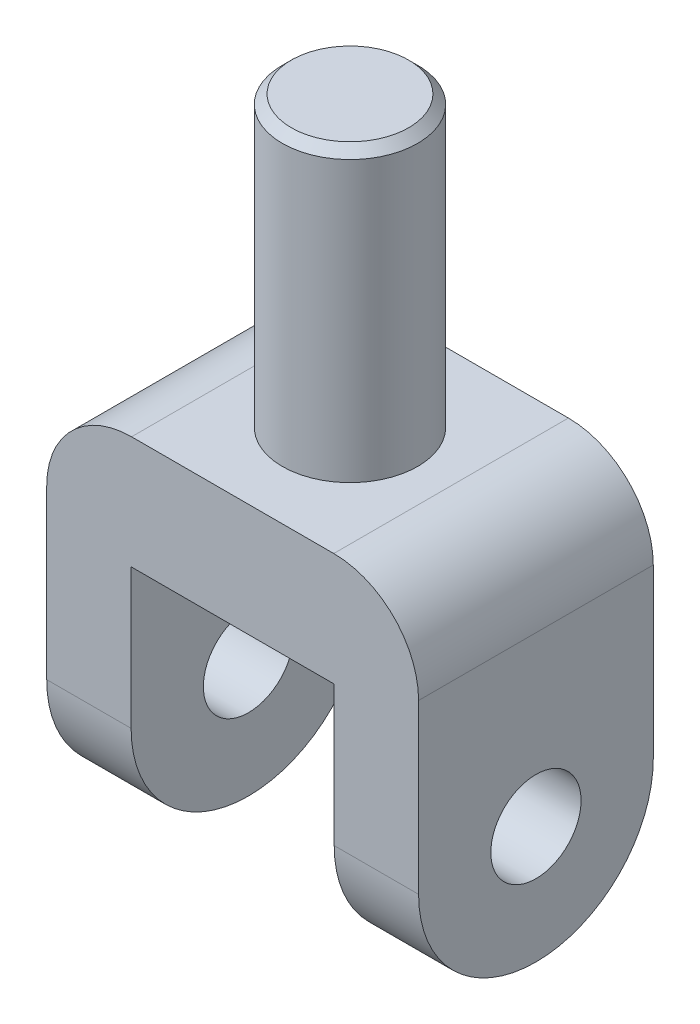
from build123d import *

# Parameters (mm, degrees)
BOSS_EXTRUDE1_DEPTH      = 33.02
BOSS_EXTRUDE1_DEPTH_BACK = 33.02
BOSS_EXTRUDE3_DEPTH      = 19.05
BOSS_EXTRUDE3_DEPTH_BACK = 19.05
SKETCH2_6_W              = 38.1
SKETCH2_6_H              = 81.28
SKETCH8_OUTSIDE_W        = 151.232
SKETCH8_OUTSIDE_H        = 112.624
SKETCH8_OUTSIDE_R        = 19.05
CUT_EXTRUDE1_DEPTH       = 81.28
CHAMFER2_SIZE            = 2.54
FILLET2_R                = 33.02
HOLE1_D                  = 25.4


with BuildPart() as part:
    # Sketch2 → Boss-Extrude1 (new, two sides: drawn at the far end of the back side and taken through both)
    with BuildSketch(Plane.XY.offset(-BOSS_EXTRUDE1_DEPTH_BACK)):
        with BuildLine():
            ThreePointArc((-52.324, 0), (-45.330881508, 16.882881508), (-28.448, 23.876))
            Line((-28.448, 23.876), (28.448, 23.876))
            ThreePointArc((28.448, 23.876), (45.330881508, 16.882881508), (52.324, 0))
            Line((52.324, 0), (52.324, -80.264))
            Line((52.324, -80.264), (28.575, -80.264))
            Line((28.575, -80.264), (28.575, -7.874))
            Line((28.575, -7.874), (-28.575, -7.874))
            Line((-28.575, -7.874), (-28.575, -80.264))
            Line((-28.575, -80.264), (-52.324, -80.264))
            Line((-52.324, -80.264), (-52.324, 0))
        make_face()
    extrude(amount=BOSS_EXTRUDE1_DEPTH + BOSS_EXTRUDE1_DEPTH_BACK)

    # Sketch2<6> → Boss-Extrude3 (add, two sides: drawn at the far end of the back side and taken through both)
    with BuildSketch(Plane.XY.offset(-BOSS_EXTRUDE3_DEPTH_BACK)):
        with Locations((0, 64.516)):
            Rectangle(SKETCH2_6_W, SKETCH2_6_H)
    extrude(amount=BOSS_EXTRUDE3_DEPTH + BOSS_EXTRUDE3_DEPTH_BACK)

    # Sketch8 outside → Cut-Extrude1 (cut)
    with BuildSketch(Plane(origin=(0, 105.156, 0), x_dir=(1, 0, 0), z_dir=(0, 1, 0))):
        Rectangle(SKETCH8_OUTSIDE_W, SKETCH8_OUTSIDE_H)
        with Locations(Location((0, 0, 0), (0, 0, 270))):
            Circle(SKETCH8_OUTSIDE_R, mode=Mode.SUBTRACT)
    extrude(amount=-CUT_EXTRUDE1_DEPTH, mode=Mode.SUBTRACT)

    # Chamfer2
    chamfer2_edges = [part.edges().sort_by_distance(p)[0] for p in [
        (0, 105.156, -19.05),
    ]]
    chamfer(chamfer2_edges, length=CHAMFER2_SIZE)

    # Fillet2
    fillet2_edges = [part.edges().sort_by_distance(p)[0] for p in [
        (-40.4495, -80.264, -33.02),
        (40.4495, -80.264, -33.02),
        (40.4495, -80.264, 33.02),
        (-40.4495, -80.264, 33.02),
    ]]
    fillet(fillet2_edges, radius=FILLET2_R - 0.0001)  # a hair under: the kernel refuses the full size

    # Hole1 (through all)
    with Locations(Plane(origin=(52.324, 0, 0), x_dir=(0, 0, -1), z_dir=(1, 0, 0))):
        with Locations((0, -47.244)):
            Hole(HOLE1_D / 2)


solid = part.part
